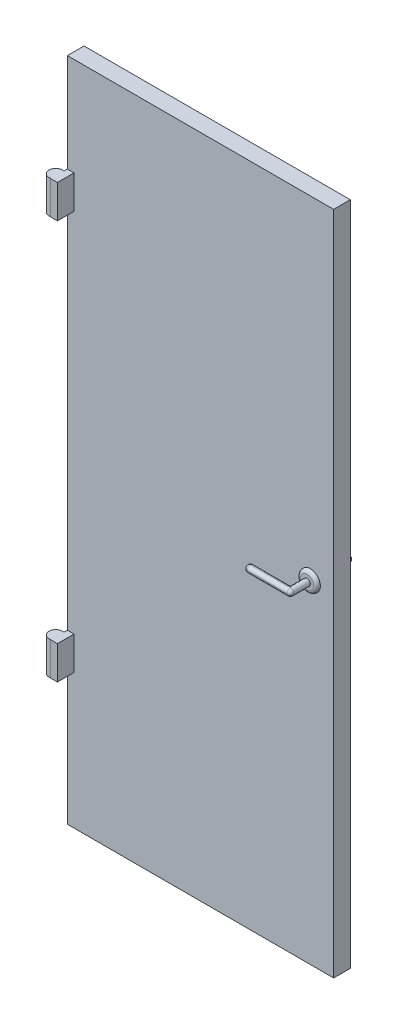
from build123d import *

# Parameters (mm, degrees)
SKETCH_1_W               = 800
SKETCH_1_H               = 2000
EXTRUDE_1_DEPTH          = 50
SKETCH_2_W               = 20
SKETCH_2_H               = 100
EXTRUDE_2_DEPTH          = 50
SKETCH_3_R               = 20
EXTRUDE_3_DEPTH          = 100
PATTERN_LINEAR_1_COUNT   = 2
PATTERN_LINEAR_1_PITCH   = 1200
SKETCH_4_R               = 30
EXTRUDE_4_DEPTH          = 10
SKETCH_5_R               = 10
EXTRUDE_5_DEPTH          = 40
EXTRUDE_6_DEPTH          = 20
FILLET_1_R               = 10
MIRROR_START             = 610
MIRROR_1_DEPTH           = 120
MIRROR_2_COPY_1_SKETCH_W = 20
MIRROR_2_COPY_1_SKETCH_H = 100
MIRROR_2_COPY_1_DEPTH    = 50
MIRROR_2_COPY_2_SKETCH_R = 20
MIRROR_2_COPY_2_DEPTH    = 100
DELETE_START             = 405
DELETE_FACE_1_DEPTH      = 1300


with BuildPart() as part:
    # Эскиз1 → Бобышка-Вытянуть1 (new body)
    with BuildSketch(Plane(origin=(46095.73955041, 0, 0), x_dir=(-1, 0, 0), z_dir=(0, 0, -1))):
        with Locations((45695.73955041, 1000)):
            Rectangle(SKETCH_1_W, SKETCH_1_H)
    extrude(amount=-EXTRUDE_1_DEPTH)

    # Эскиз2 → Бобышка-Вытянуть2 (add)
    with BuildSketch(Plane(origin=(0, 0, 0), x_dir=(-1, 0, 0), z_dir=(0, 0, -1))):
        with Locations((-10, 1655)):
            Rectangle(SKETCH_2_W, SKETCH_2_H)
    extrude_2 = extrude(amount=EXTRUDE_2_DEPTH)

    # Эскиз3 → Бобышка-Вытянуть3 (add)
    with BuildSketch(Plane(origin=(0, 1605, 0), x_dir=(-1, 0, 0), z_dir=(0, -1, 0))):
        with Locations((5, 30)):
            Circle(SKETCH_3_R)
    extrude_3 = extrude(amount=-EXTRUDE_3_DEPTH)

    # Линейный массив1: Бобышка-Вытянуть2, Бобышка-Вытянуть3 ×2
    with Locations(*[(0, -i * PATTERN_LINEAR_1_PITCH, 0) for i in range(1, PATTERN_LINEAR_1_COUNT)]):
        add(extrude_2)
        add(extrude_3)

    # Эскиз4 → Бобышка-Вытянуть4 (add)
    with BuildSketch(Plane(origin=(0, 0, 0), x_dir=(-1, 0, 0), z_dir=(0, 0, -1))):
        with Locations((-730, 1000)):
            Circle(SKETCH_4_R)
    extrude(amount=EXTRUDE_4_DEPTH)

    # Эскиз5 → Бобышка-Вытянуть5 (add)
    with BuildSketch(Plane(origin=(0, 0, -10), x_dir=(-1, 0, 0), z_dir=(0, 0, -1))):
        with Locations((-730, 1000)):
            Circle(SKETCH_5_R)
    extrude(amount=EXTRUDE_5_DEPTH)

    # Эскиз6 → Бобышка-Вытянуть6 (add)
    with BuildSketch(Plane(origin=(0, 0, -50), x_dir=(-1, 0, 0), z_dir=(0, 0, -1))):
        with BuildLine():
            Line((-730, 1010), (-610, 1010))
            ThreePointArc((-610, 1010), (-600, 1000), (-610, 990))
            Line((-610, 990), (-730, 990))
            ThreePointArc((-730, 990), (-740, 1000), (-730, 1010))
        make_face()
    extrude(amount=EXTRUDE_6_DEPTH)

    # Скругление1
    # the kernel refuses this fillet: 10 mm, written as the material it takes off along each edge
    with BuildSketch(Plane(origin=(755, 1010, -50), x_dir=(0, -1, 0), z_dir=(-1, 0, 0))) as fillet_1_piece_1_section:
        with BuildLine():
            CenterArc((FILLET_1_R, -FILLET_1_R), FILLET_1_R, 90, 90)
            Line((0, -FILLET_1_R), (0, 0))
            Line((0, 0), (FILLET_1_R, 0))
        make_face()
    fillet_1_piece_1 = extrude(amount=145, mode=Mode.PRIVATE)
    fillet_1_piece_1 = fillet_1_piece_1 - Plane(origin=(730, 1000, -50), x_dir=(-1, 0, 0), z_dir=(0, 0, 1)) * Cylinder(10, 330, mode=Mode.PRIVATE)
    add(fillet_1_piece_1, mode=Mode.SUBTRACT)
    with BuildSketch(Plane(origin=(610, 1000, -50), x_dir=(0, 1, 0), z_dir=(1, 0, 0))) as fillet_1_piece_2:
        with BuildLine():
            CenterArc((10 - FILLET_1_R, -FILLET_1_R), FILLET_1_R, 0, 90)
            Line((10, -FILLET_1_R), (10, 0))
            Line((10, 0), (10 - FILLET_1_R, 0))
        make_face()
    revolve(axis=Axis((610, 1000, -50), (0, 0, 1)), revolution_arc=180, mode=Mode.SUBTRACT)
    with BuildSketch(Plane(origin=(730, 1010, -70), x_dir=(0, 0, 1), z_dir=(-1, 0, 0)), Plane(origin=(610, 990, -70), x_dir=(0, 0, 1), z_dir=(1, 0, 0))) as fillet_1_piece_3:
        with BuildLine():
            CenterArc((FILLET_1_R, -FILLET_1_R), FILLET_1_R, 90, 90)
            Line((0, -FILLET_1_R), (0, 0))
            Line((0, 0), (FILLET_1_R, 0))
        make_face()
    extrude(amount=120, mode=Mode.SUBTRACT)
    with BuildSketch(Plane(origin=(610, 1000, -70), x_dir=(0, 1, 0), z_dir=(1, 0, 0))) as fillet_1_piece_4:
        with BuildLine():
            CenterArc((10 - FILLET_1_R, FILLET_1_R), FILLET_1_R, 270, 90)
            Line((10 - FILLET_1_R, 0), (10, 0))
            Line((10, 0), (10, FILLET_1_R))
        make_face()
    revolve(axis=Axis((610, 1000, -70), (0, 0, 1)), revolution_arc=180, mode=Mode.SUBTRACT)
    with BuildSketch(Plane(origin=(730, 1000, -70), x_dir=(0, -1, 0), z_dir=(-1, 0, 0))) as fillet_1_piece_5:
        with BuildLine():
            CenterArc((10 - FILLET_1_R, FILLET_1_R), FILLET_1_R, 270, 90)
            Line((10 - FILLET_1_R, 0), (10, 0))
            Line((10, 0), (10, FILLET_1_R))
        make_face()
    revolve(axis=Axis((730, 1000, -70), (0, 0, 1)), revolution_arc=180, mode=Mode.SUBTRACT)
    with BuildSketch(Plane(origin=(730, 1000, -10), x_dir=(-1, 0, 0), z_dir=(0, -1, 0))) as fillet_1_piece_6:
        with BuildLine():
            CenterArc((30 - FILLET_1_R, -FILLET_1_R), FILLET_1_R, 0, 90)
            Line((30 - FILLET_1_R, 0), (30, 0))
            Line((30, 0), (30, -FILLET_1_R))
        make_face()
    revolve(axis=Axis((730, 1000, -10), (0, 0, -1)), mode=Mode.SUBTRACT)
    with BuildSketch(Plane(origin=(610, 990, -50), x_dir=(0, 1, 0), z_dir=(1, 0, 0))) as fillet_1_piece_7_section:
        with BuildLine():
            CenterArc((FILLET_1_R, -FILLET_1_R), FILLET_1_R, 90, 90)
            Line((0, -FILLET_1_R), (0, 0))
            Line((0, 0), (FILLET_1_R, 0))
        make_face()
    fillet_1_piece_7 = extrude(amount=145, mode=Mode.PRIVATE)
    fillet_1_piece_7 = fillet_1_piece_7 - Plane(origin=(730, 1000, -50), x_dir=(-1, 0, 0), z_dir=(0, 0, 1)) * Cylinder(10, 330, mode=Mode.PRIVATE)
    add(fillet_1_piece_7, mode=Mode.SUBTRACT)



with BuildPart() as body_2:
    # Зеркальное отражение1: read off the stored shape, not the designer's step
    # Зеркальное отражение1 outline → Зеркальное отражение1 (new body)
    with BuildSketch(Plane.YZ.offset(MIRROR_START)):
        with BuildLine():
            ThreePointArc((1000, 120), (992.928932188, 117.071067812), (990, 110))
            ThreePointArc((990, 110), (992.928932188, 102.928932188), (1000, 100))
            ThreePointArc((1000, 100), (1007.071067812, 102.928932188), (1010, 110))
            ThreePointArc((1010, 110), (1007.071067812, 117.071067812), (1000, 120))
        make_face()
    extrude(amount=MIRROR_1_DEPTH)


with BuildPart() as part_1:
    add(part.part)

    add(body_2.part)  # Mirror 1 2 merges body 2
    # Mirror 1 2 outline → Mirror 1 2 (revolve)
    with BuildSketch(Plane(origin=(730, 1000, 0), x_dir=(1, 0, 0), z_dir=(0, -1, 0))):
        with BuildLine():
            Line((10, 60), (10, 110))
            ThreePointArc((10, 110), (7.071067812, 117.071067812), (0, 120))
            Line((0, 120), (0, 50))
            Line((0, 50), (30, 50))
            ThreePointArc((30, 50), (27.071067812, 57.071067812), (20, 60))
            Line((20, 60), (10, 60))
        make_face()
    revolve(axis=Axis((730, 1000, 0), (0, 0, 1)))

    # Mirror 1 3 outline → Mirror 1 3 (revolve)
    with BuildSketch(Plane(origin=(0, 1000, 110), x_dir=(0, 1, 0), z_dir=(0, 0, -1))):
        with BuildLine():
            Line((0, 610), (0, 600))
            ThreePointArc((0, 600), (7.071067812, 602.928932188), (10, 610))
            Line((10, 610), (0, 610))
        make_face()
    revolve(axis=Axis((0, 1000, 110), (1, 0, 0)))

    # Зеркальное отражение2: Бобышка-Вытянуть2, Бобышка-Вытянуть3 across plane
    add(extrude_2.mirror(Plane(origin=(0, 0, 25), x_dir=(1, 0, 0), z_dir=(0, 0, -1))))
    add(extrude_3.mirror(Plane(origin=(0, 0, 25), x_dir=(1, 0, 0), z_dir=(0, 0, -1))))

    # Зеркальное отражение2 copy 1 sketch → Зеркальное отражение2 copy 1 (add)
    with BuildSketch(Plane(origin=(0, -1200, 50), x_dir=(-1, 0, 0), z_dir=(0, 0, 1))):
        with Locations((-10, -1655)):
            Rectangle(MIRROR_2_COPY_1_SKETCH_W, MIRROR_2_COPY_1_SKETCH_H)
    extrude(amount=MIRROR_2_COPY_1_DEPTH)

    # Зеркальное отражение2 copy 2 sketch → Зеркальное отражение2 copy 2 (add)
    with BuildSketch(Plane(origin=(0, 405, 50), x_dir=(-1, 0, 0), z_dir=(0, -1, 0))):
        with Locations((5, -30)):
            Circle(MIRROR_2_COPY_2_SKETCH_R)
    extrude(amount=-MIRROR_2_COPY_2_DEPTH)

    # Delete Face 1: read off the stored shape, not the designer's step
    # Delete Face 1 outline → Delete Face 1 (cut)
    with BuildSketch(Plane(origin=(0, 0, 0), x_dir=(1, 0, 0), z_dir=(0, 1, 0)).offset(DELETE_START)):
        with BuildLine():
            Line((20, 50), (0, 50))
            Line((0, 50), (0, 49.364916731))
            ThreePointArc((0, 49.364916731), (-25, 30), (0, 10.635083269))
            Line((0, 10.635083269), (0, 0))
            Line((0, 0), (20, 0))
            Line((20, 0), (20, 50))
        make_face()
    extrude(amount=DELETE_FACE_1_DEPTH, mode=Mode.SUBTRACT)


solid = part_1.part
